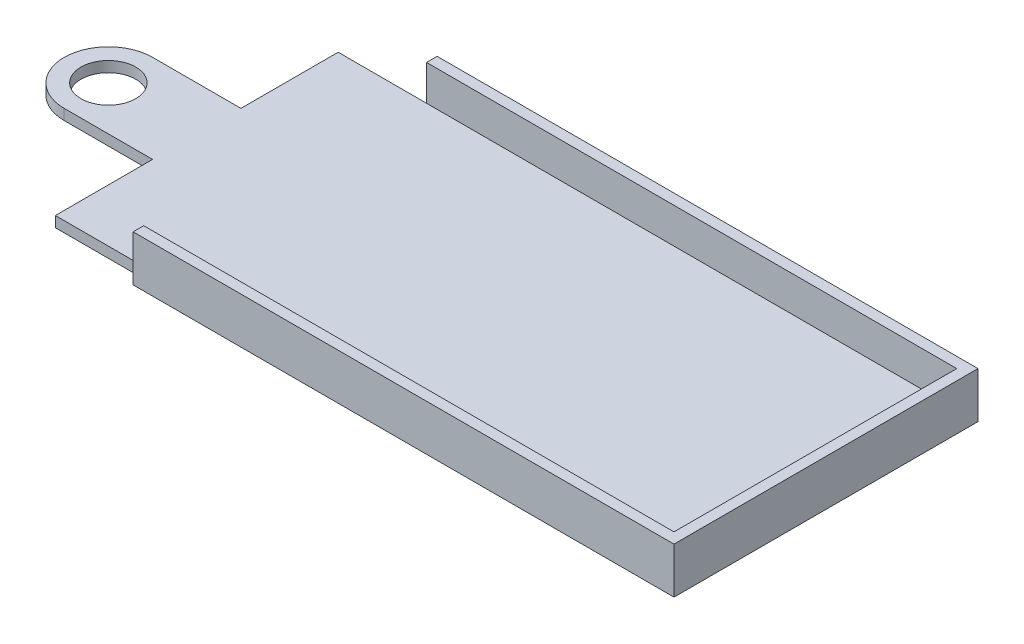
from build123d import *

# Parameters (mm, degrees)
SKETCH1_W           = 60
SKETCH1_H           = 32
BOSS_EXTRUDE1_DEPTH = 1.2
BOSS_EXTRUDE2_DEPTH = 5.2
SKETCH3_W           = 10
SKETCH3_H           = 32
BOSS_EXTRUDE3_DEPTH = 1.2
SKETCH4_W           = 15
SKETCH4_H           = 10
BOSS_EXTRUDE4_DEPTH = 1.2
FILLET1_R           = 5
CUT_EXTRUDE1_REACH  = 59.861
SKETCH5_R           = 3.1


with BuildPart() as part:
    # Sketch1 → Boss-Extrude1 (new body)
    with BuildSketch(Plane(origin=(0, 0, 0), x_dir=(1, 0, 0), z_dir=(0, 1, 0))):
        Rectangle(SKETCH1_W, SKETCH1_H)
    extrude(amount=BOSS_EXTRUDE1_DEPTH)

    # Sketch2 → Boss-Extrude2 (add)
    with BuildSketch(Plane.XZ):
        Polygon((-30, -17.2), (31.2, -17.2), (31.2, 17.2), (-30, 17.2), (-30, 16), (30, 16), (30, -16), (-30, -16), align=None)
    extrude(amount=-BOSS_EXTRUDE2_DEPTH)

    # Sketch3 → Boss-Extrude3 (add)
    with BuildSketch(Plane.XZ):
        with Locations((-35, 0)):
            Rectangle(SKETCH3_W, SKETCH3_H)
    extrude(amount=-BOSS_EXTRUDE3_DEPTH)

    # Sketch4 → Boss-Extrude4 (add)
    with BuildSketch(Plane.XZ):
        with Locations((-47.5, 0)):
            Rectangle(SKETCH4_W, SKETCH4_H)
    extrude(amount=-BOSS_EXTRUDE4_DEPTH)

    # Fillet1
    fillet1_edges = [part.edges().sort_by_distance(p)[0] for p in [
        (-55, 0.6, 5),
        (-55, 0.6, -5),
    ]]
    fillet(fillet1_edges, radius=FILLET1_R - 0.0001)  # a hair under: the kernel refuses the full size

    # Sketch5 → Cut-Extrude1 (cut, up to next)
    with BuildSketch(Plane.XZ, mode=Mode.PRIVATE) as cut_extrude1_sk1:
        with Locations(Location((-50, 0, 0), (0, 0, 270))):
            Circle(SKETCH5_R)
    cut_extrude1_tool1 = extrude(cut_extrude1_sk1.sketch, amount=-CUT_EXTRUDE1_REACH, mode=Mode.PRIVATE) & part.part
    add(cut_extrude1_tool1.solids().sort_by_distance((-50, 0, 0))[0], mode=Mode.SUBTRACT)


solid = part.part
